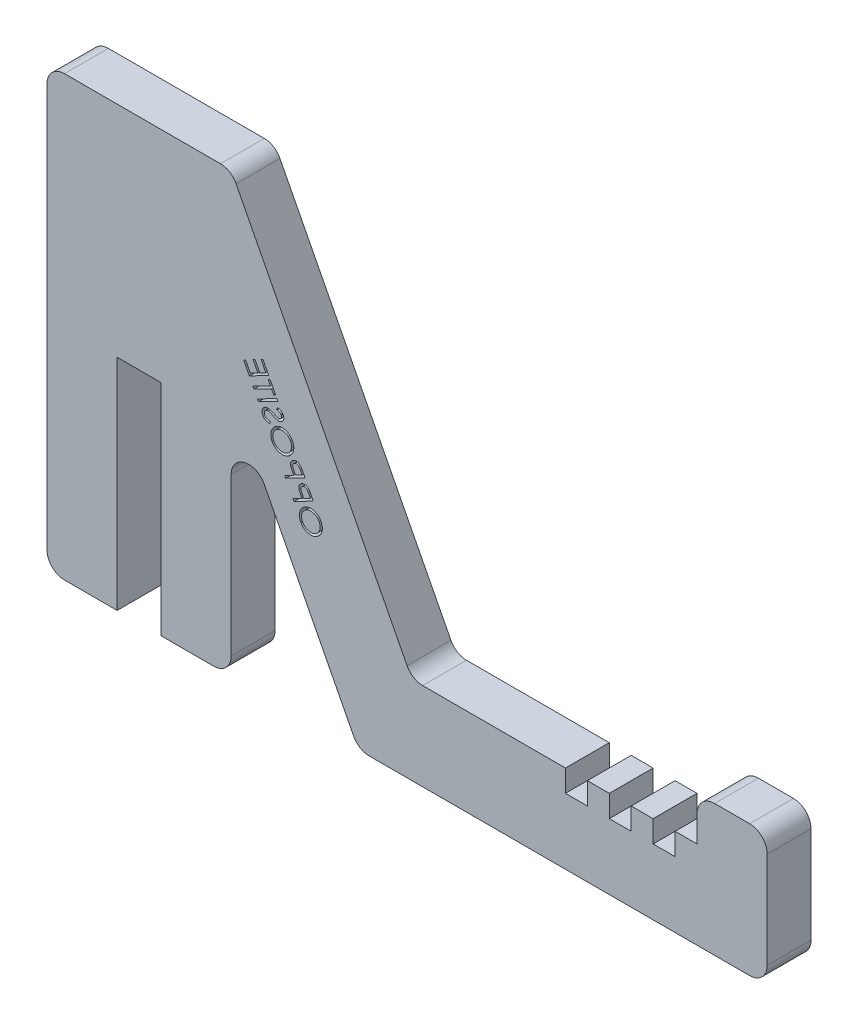
from build123d import *

# Parameters (mm, degrees)
BOSS_EXTRUDE1_DEPTH     = 5
FILLET1_R               = 2
CUT_EXTRUDE1_DEPTH      = 49.329493996
CUT_EXTRUDE1_DEPTH_BACK = 8
SKETCH2_W               = 5
SKETCH2_H               = 25
CUT_EXTRUDE4_DEPTH      = 49.329493996


with BuildPart() as part:
    # Sketch1 → Boss-Extrude1 (new body)
    with BuildSketch(Plane.XY):
        Polygon((33.057764064, -10), (33.057764064, -15), (30.557764064, -15), (30.557764064, -17.5), (28.057764064, -17.5), (28.057764064, -15), (25.557764064, -15), (25.557764064, -17.5), (23.057764064, -17.5), (23.057764064, -15), (20.557764064, -15), (20.557764064, -17.5), (18.057764064, -17.5), (18.057764064, -15), (0.557764064, -15), (-20.057764064, 25), (-41.057764064, 25), (-41.057764064, -25), (-20.057764064, -25), (-20.057764064, 3.171793747), (-5.538353904, -25), (41.057764064, -25), (41.057764064, -10), align=None)
    extrude(amount=BOSS_EXTRUDE1_DEPTH)

    # Fillet1
    fillet1_edges = [part.edges().sort_by_distance(p)[0] for p in [
        (-20.057764064, -25, 2.5),
        (33.057764064, -10, 2.5),
        (41.057764064, -10, 2.5),
        (-20.057764064, 25, 2.5),
        (-41.057764064, -25, 2.5),
        (-41.057764064, 25, 2.5),
        (0.557764064, -15, 2.5),
        (-20.057764064, 3.171793747, 2.5),
        (41.057764064, -25, 2.5),
        (-5.538353904, -25, 2.5),
    ]]
    fillet(fillet1_edges, radius=FILLET1_R)

    # Sketch2 → Cut-Extrude1 (cut, two sides: drawn at the far end of the back side and taken through both)
    with BuildSketch(Plane.XY.offset(5).offset(-CUT_EXTRUDE1_DEPTH_BACK)):
        with Locations((-30.557764064, -12.5)):
            Rectangle(SKETCH2_W, SKETCH2_H)
    extrude(amount=CUT_EXTRUDE1_DEPTH + CUT_EXTRUDE1_DEPTH_BACK, mode=Mode.SUBTRACT)

    # Sketch4 → Cut-Extrude4 (cut, through all)
    # profile 1 of 8: a face of its own
    with BuildSketch(Plane(origin=(0, 0, 0), x_dir=(-1, 0, 0), z_dir=(0, 0, -1))):
        with BuildLine():
            add(Edge.make_bspline(
                [(9.801511696, -4.616274929), (9.823613541, -4.575745177), (9.867081613, -4.496034631), (9.944488459, -4.386225626), (10.028726911, -4.286246843), (10.121388667, -4.197142968), (10.221836513, -4.11863564), (10.330475812, -4.051205195), (10.446530301, -3.994000471), (10.569120484, -3.947650159), (10.695479248, -3.913533136), (10.822492127, -3.890912918), (10.949084555, -3.882464064), (11.074950429, -3.88694773), (11.200319533, -3.904629357), (11.324897781, -3.9355014), (11.449018067, -3.978995717), (11.528788314, -4.017682089), (11.569340221, -4.037348647)],
                knots=[0, 0, 0, 0, 1.066632563, 2.097764254, 3.100015086, 4.085454937, 5.06445634, 6.042277714, 7.036537005, 8.051615149, 9.067514827, 10.058682713, 11.029693007, 11.99524916, 12.965768378, 13.951510535, 14.958632359, 16, 16, 16, 16], degree=3))
            add(Edge.make_bspline(
                [(11.569340221, -4.037348647), (11.608545277, -4.058770793), (11.685823696, -4.100996714), (11.791996135, -4.176961365), (11.889033766, -4.259918909), (11.976241765, -4.351090834), (12.051958732, -4.451764009), (12.118473941, -4.559787009), (12.174641522, -4.676129177), (12.220290073, -4.799052871), (12.254749979, -4.925586526), (12.276307002, -5.052900533), (12.285897126, -5.179388496), (12.28090647, -5.305066409), (12.264255658, -5.430061173), (12.232809452, -5.553764951), (12.190266789, -5.677227337), (12.151775411, -5.756455101), (12.132240862, -5.796663551)],
                knots=[0, 0, 0, 0, 1.04171479, 2.053359446, 3.039521027, 4.017679472, 4.990775246, 5.973545774, 6.973581496, 8.000330661, 9.029390157, 10.029069229, 11.00933521, 11.983825645, 12.958930967, 13.946230558, 14.957702701, 16, 16, 16, 16], degree=3))
            add(Edge.make_bspline(
                [(12.132240862, -5.796663551), (12.110437622, -5.836335529), (12.067497958, -5.914466183), (11.991348522, -6.022448556), (11.907290643, -6.120001464), (11.815852158, -6.208215553), (11.715047566, -6.284679051), (11.606804056, -6.351764854), (11.490580887, -6.408567019), (11.367666253, -6.454052283), (11.241453037, -6.488413581), (11.114743106, -6.510844963), (10.989036817, -6.520020457), (10.864367449, -6.515828605), (10.740637899, -6.499384607), (10.618013674, -6.469528592), (10.496367863, -6.426843667), (10.418170095, -6.389206118), (10.378434772, -6.370081019)],
                knots=[0, 0, 0, 0, 1.056990835, 2.081655299, 3.079996136, 4.062015271, 5.044104105, 6.030095945, 7.033035091, 8.061011973, 9.087537746, 10.085230842, 11.062778891, 12.0266078, 12.994625509, 13.973673958, 14.970345053, 16, 16, 16, 16], degree=3))
            add(Edge.make_bspline(
                [(10.378434772, -6.370081019), (10.352330337, -6.356113852), (10.300450458, -6.328355546), (10.227121644, -6.280070479), (10.156480763, -6.229528196), (10.091142078, -6.17326842), (10.028438872, -6.114551649), (9.971210044, -6.050381767), (9.916568394, -5.983316875), (9.866930523, -5.911774353), (9.821491129, -5.837841155), (9.781824837, -5.76156936), (9.746854683, -5.684046791), (9.718758487, -5.604260272), (9.694854077, -5.52345354), (9.676814123, -5.440945582), (9.664312971, -5.356780939), (9.657426976, -5.271460614), (9.655685975, -5.185796752), (9.660465463, -5.10100659), (9.669870551, -5.01717772), (9.684896653, -4.934686469), (9.705470696, -4.852976444), (9.732117648, -4.772802278), (9.763679399, -4.693410588), (9.788815314, -4.642161377), (9.801511696, -4.616274929)],
                knots=[0, 0, 0, 0, 1.037256786, 2.061441141, 3.075039414, 4.07978187, 5.081418259, 6.083977232, 7.091068454, 8.112155579, 9.133795872, 10.131012574, 11.123824406, 12.112211735, 13.093645848, 14.076160933, 15.070058586, 16.074033953, 17.074815338, 18.07098421, 19.04869556, 20.030042446, 21.007893874, 21.999739532, 22.989650014, 24, 24, 24, 24], degree=3))
        make_face()
        with BuildLine():
            add(Edge.make_bspline(
                [(10.023366664, -4.717436788), (10.013223256, -4.738003564), (9.993066644, -4.778873117), (9.968185841, -4.842224707), (9.947403968, -4.906579205), (9.931545049, -4.972422671), (9.919393794, -5.039448676), (9.911892913, -5.107888731), (9.908941726, -5.177480762), (9.910410024, -5.247910302), (9.916547915, -5.318121352), (9.926258082, -5.387284978), (9.941162468, -5.454757246), (9.959372339, -5.520812736), (9.982593319, -5.585213293), (10.010298378, -5.647823294), (10.04183959, -5.709172344), (10.077813295, -5.768574818), (10.117850876, -5.82558918), (10.161504767, -5.879804474), (10.208691661, -5.930991722), (10.259387254, -5.979169432), (10.313622699, -6.024288328), (10.371202349, -6.066466498), (10.432639331, -6.105116638), (10.475460148, -6.128422162), (10.497124676, -6.14021323)],
                knots=[0, 0, 0, 0, 0.989589386, 1.966476136, 2.935061073, 3.906857685, 4.887882231, 5.873896613, 6.876519821, 7.892853037, 8.912629515, 9.917503341, 10.905517114, 11.893425756, 12.873602947, 13.857745808, 14.847230231, 15.849542612, 16.853175341, 17.852582012, 18.852170537, 19.856346435, 20.869455381, 21.89572958, 22.935376976, 24, 24, 24, 24], degree=3))
            add(Edge.make_bspline(
                [(10.497124676, -6.14021323), (10.529729495, -6.15605362), (10.59388846, -6.187223951), (10.693826939, -6.222243589), (10.794114152, -6.246944816), (10.89513832, -6.261227776), (10.996494583, -6.264493673), (11.098561566, -6.258203703), (11.201029223, -6.240301475), (11.30284369, -6.212280329), (11.4018549, -6.175689321), (11.495258745, -6.130548915), (11.582290455, -6.077583291), (11.662476721, -6.016605176), (11.735456362, -5.947123313), (11.802651148, -5.870830236), (11.862438038, -5.785824396), (11.896254342, -5.724549463), (11.913390702, -5.693498486)],
                knots=[0, 0, 0, 0, 1.051790112, 2.069686862, 3.067737986, 4.046573341, 5.026236362, 6.00733714, 7.010553343, 8.040575373, 9.06963903, 10.071156048, 11.047889103, 12.023117742, 12.989999877, 13.968943228, 14.97076514, 16, 16, 16, 16], degree=3))
            add(Edge.make_bspline(
                [(11.913390702, -5.693498486), (11.924085359, -5.6721192), (11.945311587, -5.629686645), (11.970864695, -5.563738233), (11.99323747, -5.497525105), (12.010966862, -5.430309538), (12.023078544, -5.362087905), (12.032088725, -5.293259706), (12.035156191, -5.223612476), (12.034821186, -5.15355787), (12.030079106, -5.083896171), (12.019696562, -5.015389515), (12.00571874, -4.948328831), (11.987987581, -4.882530998), (11.964670126, -4.818703169), (11.936840434, -4.756499327), (11.905588169, -4.695328701), (11.869323462, -4.636262605), (11.829403331, -4.579487774), (11.786274815, -4.524992676), (11.739253369, -4.47390771), (11.688204106, -4.426495487), (11.634850416, -4.380827874), (11.576772336, -4.339820893), (11.516376903, -4.299984008), (11.473388621, -4.277222976), (11.45165192, -4.265714031)],
                knots=[0, 0, 0, 0, 1.027959219, 2.040242785, 3.039576589, 4.03427981, 5.02742605, 6.018934827, 7.018526689, 8.024061282, 9.032132035, 10.019417724, 11.002619592, 11.978369363, 12.948499141, 13.922767536, 14.908929245, 15.901737816, 16.902000321, 17.893561122, 18.889793003, 19.885662363, 20.889862266, 21.908470364, 22.942433777, 24, 24, 24, 24], degree=3))
            add(Edge.make_bspline(
                [(11.45165192, -4.265714031), (11.429732872, -4.254948387), (11.386441028, -4.233685393), (11.320135949, -4.206435134), (11.253207368, -4.184616728), (11.186141495, -4.166244027), (11.11833619, -4.153157485), (11.050010132, -4.1454685), (10.981461618, -4.141085801), (10.912675609, -4.142289003), (10.844462941, -4.147859928), (10.776792077, -4.157186307), (10.710360929, -4.171733753), (10.644964641, -4.191169042), (10.580228065, -4.213725266), (10.517175992, -4.242324072), (10.454657041, -4.274184662), (10.394144336, -4.311194686), (10.335632219, -4.351670541), (10.28016109, -4.395021315), (10.228295713, -4.441351288), (10.179915656, -4.49053779), (10.13554593, -4.543175142), (10.094445745, -4.598378779), (10.056320568, -4.656153649), (10.034413935, -4.696892592), (10.023366664, -4.717436788)],
                knots=[0, 0, 0, 0, 1.054707469, 2.083130161, 3.093315378, 4.093854564, 5.085230943, 6.072691992, 7.06228343, 8.050297243, 9.0413851, 10.017325617, 10.998924117, 11.975583657, 12.963176344, 13.957459493, 14.963699213, 15.992627396, 17.018772293, 18.035754999, 19.031631949, 20.020881782, 21.013437607, 22.002792562, 22.992830537, 24, 24, 24, 24], degree=3))
        make_face(mode=Mode.SUBTRACT)
    # profile 2 of 8: a face of its own
    with BuildSketch(Plane(origin=(0, 0, 0), x_dir=(-1, 0, 0), z_dir=(0, 0, -1))):
        with BuildLine():
            Line((10.692971556, -3.021946225), (10.920335338, -2.581741898))
            add(Edge.make_bspline(
                [(10.920335338, -2.581741898), (10.936152805, -2.551505532), (10.966371863, -2.493739362), (11.010368714, -2.411209556), (11.051998942, -2.337204828), (11.090323346, -2.271109749), (11.125823835, -2.213450395), (11.158345031, -2.164024518), (11.188189666, -2.122973284), (11.207866977, -2.098894765), (11.216809697, -2.087951834)],
                knots=[0, 0, 0, 0, 1.419510024, 2.71195483, 3.890283711, 4.951476777, 5.889999496, 6.706616563, 7.412197862, 8, 8, 8, 8], degree=3))
            add(Edge.make_bspline(
                [(11.216809697, -2.087951834), (11.228940049, -2.074544815), (11.25289034, -2.04807386), (11.292370274, -2.012531403), (11.333277368, -1.980425677), (11.376292499, -1.952058102), (11.421197134, -1.927614541), (11.468285389, -1.906896983), (11.517171326, -1.88990763), (11.567935003, -1.87693305), (11.619800362, -1.867725934), (11.672470139, -1.86377073), (11.725455688, -1.864775532), (11.778756557, -1.870879805), (11.832554912, -1.881957669), (11.88652108, -1.898229377), (11.941200165, -1.918561166), (11.976508059, -1.936205412), (11.994554088, -1.945223469)],
                knots=[0, 0, 0, 0, 1.011413309, 1.996944693, 2.968872661, 3.919961939, 4.877455315, 5.827120703, 6.796350115, 7.77083479, 8.757030353, 9.740965877, 10.722235868, 11.718998114, 12.739691427, 13.792179139, 14.871572489, 16, 16, 16, 16], degree=3))
            add(Edge.make_bspline(
                [(11.994554088, -1.945223469), (12.012417379, -1.954786708), (12.047392604, -1.973510944), (12.096096739, -2.005958755), (12.140908276, -2.040296665), (12.180933687, -2.07768307), (12.21755493, -2.116701073), (12.248944644, -2.158895968), (12.276209668, -2.203334129), (12.299377328, -2.249867472), (12.317552354, -2.298504898), (12.332620421, -2.348224932), (12.341679665, -2.399512638), (12.347512297, -2.45188441), (12.348171251, -2.50549069), (12.345442259, -2.560448115), (12.337193197, -2.616490795), (12.328826649, -2.653906167), (12.324582133, -2.672887731)],
                knots=[0, 0, 0, 0, 1.116554278, 2.18614466, 3.222632161, 4.225642221, 5.202640085, 6.169045809, 7.1193197, 8.074262178, 9.029781083, 9.979252341, 10.934194818, 11.896735958, 12.881721431, 13.886461366, 14.927759714, 16, 16, 16, 16], degree=3))
            add(Edge.make_bspline(
                [(12.324582133, -2.672887731), (12.320434367, -2.688305192), (12.311374681, -2.721980514), (12.29210954, -2.77550033), (12.268917085, -2.836986341), (12.239385664, -2.905770472), (12.204965094, -2.982057361), (12.165131589, -3.065991648), (12.120175547, -3.15754176), (12.087642377, -3.220817864), (12.070675883, -3.253817219)],
                knots=[0, 0, 0, 0, 0.603150067, 1.317420077, 2.148134559, 3.086716999, 4.145594464, 5.311116333, 6.597710332, 8, 8, 8, 8], degree=3))
            Line((12.070675883, -3.253817219), (11.989045274, -3.411569623))
            Line((11.989045274, -3.411569623), (13.016689505, -3.94191818))
            Line((13.016689505, -3.94191818), (12.903007614, -4.162771546))
            Line((12.903007614, -4.162771546), (10.692971556, -3.021946225))
        make_face()
        with BuildLine():
            Line((11.021497197, -2.911769943), (11.77269912, -3.299890937))
            Line((11.77269912, -3.299890937), (11.970515626, -2.927795584))
            add(Edge.make_bspline(
                [(11.970515626, -2.927795584), (11.979780831, -2.909474546), (11.997707149, -2.874026999), (12.022236819, -2.822156896), (12.043444811, -2.773219829), (12.061523604, -2.727516773), (12.075945808, -2.684821203), (12.087962181, -2.645547201), (12.095796802, -2.609152665), (12.102702927, -2.565334281), (12.104289306, -2.513084638), (12.09699919, -2.452498281), (12.07941033, -2.394475601), (12.053377123, -2.339481733), (12.019507344, -2.288794711), (11.978857474, -2.243227003), (11.930959741, -2.204458428), (11.895037866, -2.183959039), (11.876865787, -2.173588853)],
                knots=[0, 0, 0, 0, 1.137135783, 2.200130434, 3.177479121, 4.090939139, 4.921351381, 5.673257979, 6.364255076, 6.981471147, 8.12859989, 9.246782082, 10.346733602, 11.471737877, 12.605221442, 13.711721158, 14.842410562, 16, 16, 16, 16], degree=3))
            add(Edge.make_bspline(
                [(11.876865787, -2.173588853), (11.858233265, -2.164806216), (11.821582651, -2.147530558), (11.762798327, -2.132169856), (11.702785698, -2.124908949), (11.642050035, -2.127143132), (11.582795443, -2.137348082), (11.526793427, -2.156243042), (11.474662519, -2.182806847), (11.4347761, -2.212610949), (11.404578074, -2.241692172), (11.380793259, -2.268111293), (11.356438924, -2.299102838), (11.331479588, -2.334890109), (11.305481071, -2.375010274), (11.278417607, -2.419502052), (11.250961902, -2.468752947), (11.232764008, -2.50324507), (11.223320114, -2.521144943)],
                knots=[0, 0, 0, 0, 1.168264119, 2.298003391, 3.434531283, 4.592352176, 5.738536383, 6.839355403, 7.938088335, 9.049764743, 9.653550643, 10.318397515, 11.067971438, 11.891659399, 12.796692311, 13.784114278, 14.850054205, 16, 16, 16, 16], degree=3))
            Line((11.223320114, -2.521144943), (11.021497197, -2.911769943))
        make_face(mode=Mode.SUBTRACT)
    # profile 3 of 8: a face of its own
    with BuildSketch(Plane(origin=(0, 0, 0), x_dir=(-1, 0, 0), z_dir=(0, 0, -1))):
        with BuildLine():
            Line((11.63271073, -1.198584402), (11.860074512, -0.758380075))
            add(Edge.make_bspline(
                [(11.860074512, -0.758380075), (11.875891979, -0.728143709), (11.906111037, -0.670377538), (11.950107888, -0.587847733), (11.991738116, -0.513843004), (12.03006252, -0.447747926), (12.065563009, -0.390088572), (12.098084205, -0.340662694), (12.12792884, -0.299611461), (12.147606151, -0.275532941), (12.156548871, -0.264590011)],
                knots=[0, 0, 0, 0, 1.419510024, 2.71195483, 3.890283711, 4.951476777, 5.889999496, 6.706616563, 7.412197862, 8, 8, 8, 8], degree=3))
            add(Edge.make_bspline(
                [(12.156548871, -0.264590011), (12.168679223, -0.251182991), (12.192629514, -0.224712036), (12.232109448, -0.18916958), (12.273016542, -0.157063853), (12.316031673, -0.128696279), (12.360936308, -0.104252718), (12.408024563, -0.083535159), (12.4569105, -0.066545807), (12.507674177, -0.053571226), (12.559539536, -0.044364111), (12.612209313, -0.040408907), (12.665194862, -0.041413708), (12.718495731, -0.047517982), (12.772294086, -0.058595846), (12.826260254, -0.074867553), (12.880939339, -0.095199343), (12.916247233, -0.112843589), (12.934293262, -0.121861645)],
                knots=[0, 0, 0, 0, 1.011413309, 1.996944693, 2.968872661, 3.919961939, 4.877455315, 5.827120703, 6.796350115, 7.77083479, 8.757030353, 9.740965877, 10.722235868, 11.718998114, 12.739691427, 13.792179139, 14.871572489, 16, 16, 16, 16], degree=3))
            add(Edge.make_bspline(
                [(12.934293262, -0.121861645), (12.952156553, -0.131424885), (12.987131778, -0.150149121), (13.035835913, -0.182596931), (13.08064745, -0.216934842), (13.120672861, -0.254321247), (13.157294104, -0.293339249), (13.188683818, -0.335534145), (13.215948842, -0.379972306), (13.239116502, -0.426505649), (13.257291528, -0.475143074), (13.272359595, -0.524863109), (13.281418839, -0.576150815), (13.287251471, -0.628522586), (13.287910424, -0.682128867), (13.285181433, -0.737086292), (13.27693237, -0.793128971), (13.268565823, -0.830544344), (13.264321307, -0.849525908)],
                knots=[0, 0, 0, 0, 1.116554278, 2.18614466, 3.222632161, 4.225642221, 5.202640085, 6.169045809, 7.1193197, 8.074262178, 9.029781083, 9.979252341, 10.934194818, 11.896735958, 12.881721431, 13.886461366, 14.927759714, 16, 16, 16, 16], degree=3))
            add(Edge.make_bspline(
                [(13.264321307, -0.849525908), (13.260173541, -0.864943369), (13.251113855, -0.898618691), (13.231848714, -0.952138507), (13.208656259, -1.013624518), (13.179124838, -1.082408649), (13.144704267, -1.158695538), (13.104870762, -1.242629825), (13.059914721, -1.334179936), (13.027381551, -1.39745604), (13.010415057, -1.430455395)],
                knots=[0, 0, 0, 0, 0.603150067, 1.317420077, 2.148134559, 3.086716999, 4.145594464, 5.311116333, 6.597710332, 8, 8, 8, 8], degree=3))
            Line((13.010415057, -1.430455395), (12.928784448, -1.588207799))
            Line((12.928784448, -1.588207799), (13.956428679, -2.118556357))
            Line((13.956428679, -2.118556357), (13.842746788, -2.339409722))
            Line((13.842746788, -2.339409722), (11.63271073, -1.198584402))
        make_face()
        with BuildLine():
            Line((11.961236371, -1.08840812), (12.712438294, -1.476529113))
            Line((12.712438294, -1.476529113), (12.9102548, -1.104433761))
            add(Edge.make_bspline(
                [(12.9102548, -1.104433761), (12.919520005, -1.086112722), (12.937446323, -1.050665175), (12.961975993, -0.998795072), (12.983183985, -0.949858006), (13.001262778, -0.904154949), (13.015684982, -0.86145938), (13.027701355, -0.822185378), (13.035535976, -0.785790841), (13.0424421, -0.741972457), (13.04402848, -0.689722815), (13.036738364, -0.629136458), (13.019149504, -0.571113778), (12.993116296, -0.51611991), (12.959246518, -0.465432887), (12.918596648, -0.41986518), (12.870698915, -0.381096604), (12.83477704, -0.360597215), (12.816604961, -0.35022703)],
                knots=[0, 0, 0, 0, 1.137135783, 2.200130434, 3.177479121, 4.090939139, 4.921351381, 5.673257979, 6.364255076, 6.981471147, 8.12859989, 9.246782082, 10.346733602, 11.471737877, 12.605221442, 13.711721158, 14.842410562, 16, 16, 16, 16], degree=3))
            add(Edge.make_bspline(
                [(12.816604961, -0.35022703), (12.797972439, -0.341444392), (12.761321824, -0.324168735), (12.702537501, -0.308808032), (12.642524872, -0.301547126), (12.581789209, -0.303781309), (12.522534617, -0.313986259), (12.466532601, -0.332881218), (12.414401693, -0.359445024), (12.374515274, -0.389249126), (12.344317248, -0.418330348), (12.320532433, -0.44474947), (12.296178098, -0.475741015), (12.271218762, -0.511528285), (12.245220244, -0.55164845), (12.218156781, -0.596140228), (12.190701076, -0.645391124), (12.172503182, -0.679883247), (12.163059288, -0.69778312)],
                knots=[0, 0, 0, 0, 1.168264119, 2.298003391, 3.434531283, 4.592352176, 5.738536383, 6.839355403, 7.938088335, 9.049764743, 9.653550643, 10.318397515, 11.067971438, 11.891659399, 12.796692311, 13.784114278, 14.850054205, 16, 16, 16, 16], degree=3))
            Line((12.163059288, -0.69778312), (11.961236371, -1.08840812))
        make_face(mode=Mode.SUBTRACT)
    # profile 4 of 8: a face of its own
    with BuildSketch(Plane(origin=(0, 0, 0), x_dir=(-1, 0, 0), z_dir=(0, 0, -1))):
        with BuildLine():
            add(Edge.make_bspline(
                [(13.061231955, 1.708511396), (13.0833338, 1.749041148), (13.126801872, 1.828751694), (13.204208719, 1.938560698), (13.288447171, 2.038539482), (13.381108926, 2.127643357), (13.481556773, 2.206150685), (13.590196072, 2.27358113), (13.706250561, 2.330785854), (13.828840743, 2.377136165), (13.955199507, 2.411253188), (14.082212386, 2.433873407), (14.208804814, 2.442322261), (14.334670689, 2.437838595), (14.460039793, 2.420156968), (14.58461804, 2.389284925), (14.708738327, 2.345790608), (14.788508574, 2.307104236), (14.829060481, 2.287437678)],
                knots=[0, 0, 0, 0, 1.066632563, 2.097764254, 3.100015086, 4.085454937, 5.06445634, 6.042277714, 7.036537005, 8.051615149, 9.067514827, 10.058682713, 11.029693007, 11.99524916, 12.965768378, 13.951510535, 14.958632359, 16, 16, 16, 16], degree=3))
            add(Edge.make_bspline(
                [(14.829060481, 2.287437678), (14.868265537, 2.266015532), (14.945543955, 2.22378961), (15.051716395, 2.14782496), (15.148754025, 2.064867416), (15.235962024, 1.97369549), (15.311678991, 1.873022316), (15.3781942, 1.764999316), (15.434361782, 1.648657148), (15.480010333, 1.525733454), (15.514470238, 1.399199799), (15.536027262, 1.271885791), (15.545617386, 1.145397829), (15.540626729, 1.019719916), (15.523975918, 0.894725152), (15.492529712, 0.771021374), (15.449987048, 0.647558988), (15.41149567, 0.568331224), (15.391961122, 0.528122774)],
                knots=[0, 0, 0, 0, 1.04171479, 2.053359446, 3.039521027, 4.017679472, 4.990775246, 5.973545774, 6.973581496, 8.000330661, 9.029390157, 10.029069229, 11.00933521, 11.983825645, 12.958930967, 13.946230558, 14.957702701, 16, 16, 16, 16], degree=3))
            add(Edge.make_bspline(
                [(15.391961122, 0.528122774), (15.370157881, 0.488450795), (15.327218218, 0.410320142), (15.251068781, 0.302337768), (15.167010902, 0.204784861), (15.075572418, 0.116570772), (14.974767825, 0.040107274), (14.866524316, -0.026978529), (14.750301147, -0.083780695), (14.627386513, -0.129265958), (14.501173297, -0.163627257), (14.374463365, -0.186058639), (14.248757077, -0.195234132), (14.124087709, -0.19104228), (14.000358158, -0.174598282), (13.877733934, -0.144742267), (13.756088122, -0.102057342), (13.677890354, -0.064419794), (13.638155032, -0.045294694)],
                knots=[0, 0, 0, 0, 1.056990835, 2.081655299, 3.079996136, 4.062015271, 5.044104105, 6.030095945, 7.033035091, 8.061011973, 9.087537746, 10.085230842, 11.062778891, 12.0266078, 12.994625509, 13.973673958, 14.970345053, 16, 16, 16, 16], degree=3))
            add(Edge.make_bspline(
                [(13.638155032, -0.045294694), (13.612050597, -0.031327527), (13.560170717, -0.003569221), (13.486841904, 0.044715846), (13.416201023, 0.095258129), (13.350862337, 0.151517905), (13.288159131, 0.210234676), (13.230930304, 0.274404558), (13.176288653, 0.34146945), (13.126650783, 0.413011972), (13.081211388, 0.48694517), (13.041545096, 0.563216965), (13.006574943, 0.640739534), (12.978478746, 0.720526053), (12.954574336, 0.801332785), (12.936534383, 0.883840743), (12.92403323, 0.968005386), (12.917147236, 1.053325711), (12.915406235, 1.138989573), (12.920185723, 1.223779735), (12.92959081, 1.307608605), (12.944616912, 1.390099856), (12.965190955, 1.471809881), (12.991837908, 1.551984047), (13.023399659, 1.631375737), (13.048535573, 1.682624948), (13.061231955, 1.708511396)],
                knots=[0, 0, 0, 0, 1.037256786, 2.061441141, 3.075039414, 4.07978187, 5.081418259, 6.083977232, 7.091068454, 8.112155579, 9.133795872, 10.131012574, 11.123824406, 12.112211735, 13.093645848, 14.076160933, 15.070058586, 16.074033953, 17.074815338, 18.07098421, 19.04869556, 20.030042446, 21.007893874, 21.999739532, 22.989650014, 24, 24, 24, 24], degree=3))
        make_face()
        with BuildLine():
            add(Edge.make_bspline(
                [(13.283086923, 1.607349537), (13.272943516, 1.58678276), (13.252786904, 1.545913208), (13.227906101, 1.482561617), (13.207124227, 1.41820712), (13.191265309, 1.352363654), (13.179114053, 1.285337649), (13.171613173, 1.216897594), (13.168661986, 1.147305563), (13.170130284, 1.076876023), (13.176268175, 1.006664972), (13.185978341, 0.937501347), (13.200882727, 0.870029079), (13.219092598, 0.803973589), (13.242313579, 0.739573031), (13.270018637, 0.676963031), (13.301559849, 0.615613981), (13.337533555, 0.556211506), (13.377571136, 0.499197144), (13.421225026, 0.444981851), (13.46841192, 0.393794603), (13.519107513, 0.345616893), (13.573342959, 0.300497997), (13.630922609, 0.258319827), (13.692359591, 0.219669687), (13.735180407, 0.196364163), (13.756844936, 0.184573095)],
                knots=[0, 0, 0, 0, 0.989589386, 1.966476136, 2.935061073, 3.906857685, 4.887882231, 5.873896613, 6.876519821, 7.892853037, 8.912629515, 9.917503341, 10.905517114, 11.893425756, 12.873602947, 13.857745808, 14.847230231, 15.849542612, 16.853175341, 17.852582012, 18.852170537, 19.856346435, 20.869455381, 21.89572958, 22.935376976, 24, 24, 24, 24], degree=3))
            add(Edge.make_bspline(
                [(13.756844936, 0.184573095), (13.789449755, 0.168732705), (13.85360872, 0.137562374), (13.953547199, 0.102542736), (14.053834412, 0.077841509), (14.15485858, 0.063558549), (14.256214843, 0.060292652), (14.358281825, 0.066582622), (14.460749482, 0.08448485), (14.56256395, 0.112505996), (14.66157516, 0.149097004), (14.754979004, 0.19423741), (14.842010715, 0.247203033), (14.922196981, 0.308181149), (14.995176621, 0.377663012), (15.062371408, 0.453956088), (15.122158297, 0.538961928), (15.155974602, 0.600236861), (15.173110962, 0.631287838)],
                knots=[0, 0, 0, 0, 1.051790112, 2.069686862, 3.067737986, 4.046573341, 5.026236362, 6.00733714, 7.010553343, 8.040575373, 9.06963903, 10.071156048, 11.047889103, 12.023117742, 12.989999877, 13.968943228, 14.97076514, 16, 16, 16, 16], degree=3))
            add(Edge.make_bspline(
                [(15.173110962, 0.631287838), (15.183805619, 0.652667125), (15.205031847, 0.69509968), (15.230584955, 0.761048092), (15.252957729, 0.827261219), (15.270687122, 0.894476787), (15.282798804, 0.962698419), (15.291808984, 1.031526619), (15.29487645, 1.101173849), (15.294541446, 1.171228454), (15.289799366, 1.240890154), (15.279416821, 1.30939681), (15.265438999, 1.376457494), (15.247707841, 1.442255327), (15.224390386, 1.506083156), (15.196560694, 1.568286998), (15.165308429, 1.629457624), (15.129043721, 1.688523719), (15.08912359, 1.745298551), (15.045995075, 1.799793649), (14.998973628, 1.850878615), (14.947924366, 1.898290838), (14.894570676, 1.94395845), (14.836492595, 1.984965431), (14.776097163, 2.024802317), (14.733108881, 2.047563349), (14.711372179, 2.059072293)],
                knots=[0, 0, 0, 0, 1.027959219, 2.040242785, 3.039576589, 4.03427981, 5.02742605, 6.018934827, 7.018526689, 8.024061282, 9.032132035, 10.019417724, 11.002619592, 11.978369363, 12.948499141, 13.922767536, 14.908929245, 15.901737816, 16.902000321, 17.893561122, 18.889793003, 19.885662363, 20.889862266, 21.908470364, 22.942433777, 24, 24, 24, 24], degree=3))
            add(Edge.make_bspline(
                [(14.711372179, 2.059072293), (14.689453131, 2.069837938), (14.646161288, 2.091100932), (14.579856208, 2.11835119), (14.512927627, 2.140169597), (14.445861754, 2.158542297), (14.37805645, 2.17162884), (14.309730391, 2.179317825), (14.241181877, 2.183700524), (14.172395869, 2.182497322), (14.1041832, 2.176926397), (14.036512337, 2.167600018), (13.970081189, 2.153052572), (13.904684901, 2.133617283), (13.839948324, 2.111061059), (13.776896251, 2.082462253), (13.714377301, 2.050601663), (13.653864596, 2.013591639), (13.595352478, 1.973115784), (13.53988135, 1.92976501), (13.488015973, 1.883435036), (13.439635915, 1.834248535), (13.395266189, 1.781611183), (13.354166004, 1.726407546), (13.316040828, 1.668632676), (13.294134194, 1.627893732), (13.283086923, 1.607349537)],
                knots=[0, 0, 0, 0, 1.054707469, 2.083130161, 3.093315378, 4.093854564, 5.085230943, 6.072691992, 7.06228343, 8.050297243, 9.0413851, 10.017325617, 10.998924117, 11.975583657, 12.963176344, 13.957459493, 14.963699213, 15.992627396, 17.018772293, 18.035754999, 19.031631949, 20.020881782, 21.013437607, 22.002792562, 22.992830537, 24, 24, 24, 24], degree=3))
        make_face(mode=Mode.SUBTRACT)
    # profile 5 of 8: a face of its own
    with BuildSketch(Plane(origin=(0, 0, 0), x_dir=(-1, 0, 0), z_dir=(0, 0, -1))):
        with BuildLine():
            Line((15.633881719, 2.147491542), (15.617856078, 2.393885773))
            add(Edge.make_bspline(
                [(15.617856078, 2.393885773), (15.655127124, 2.395448882), (15.726424416, 2.398439018), (15.828255903, 2.412323477), (15.919768744, 2.4341278), (16.001202311, 2.463214697), (16.072102067, 2.501065836), (16.132260131, 2.547178847), (16.183591408, 2.600379961), (16.207764847, 2.642375359), (16.219819219, 2.663316863)],
                knots=[0, 0, 0, 0, 1.292063475, 2.47164048, 3.554689806, 4.546504908, 5.460076821, 6.326585784, 7.165532124, 8, 8, 8, 8], degree=3))
            add(Edge.make_bspline(
                [(16.219819219, 2.663316863), (16.228664875, 2.681979453), (16.246184194, 2.718941763), (16.263574746, 2.777659115), (16.27363668, 2.837716136), (16.276461558, 2.898539438), (16.273028569, 2.958704064), (16.260728069, 3.016082647), (16.241700586, 3.070255573), (16.214513436, 3.11980689), (16.181929895, 3.164973614), (16.144711936, 3.205051039), (16.102260746, 3.239057086), (16.070844513, 3.256842404), (16.055055598, 3.265780805)],
                knots=[0, 0, 0, 0, 1.069206052, 2.117622752, 3.16174587, 4.218661991, 5.267935299, 6.275975927, 7.250327606, 8.233704792, 9.194320259, 10.130942197, 11.060664136, 12, 12, 12, 12], degree=3))
            add(Edge.make_bspline(
                [(16.055055598, 3.265780805), (16.03611609, 3.274531901), (15.997856115, 3.292210118), (15.934671402, 3.30539078), (15.867701468, 3.310323911), (15.822165879, 3.305719316), (15.798645341, 3.303340901)],
                knots=[0, 0, 0, 0, 0.948731457, 1.916546201, 2.923831773, 4, 4, 4, 4], degree=3))
            add(Edge.make_bspline(
                [(15.798645341, 3.303340901), (15.781072382, 3.300568262), (15.7441743, 3.294746529), (15.686914138, 3.280720977), (15.625147171, 3.262689206), (15.558658551, 3.240466792), (15.487562836, 3.213767557), (15.411666497, 3.1828815), (15.331406285, 3.146965127), (15.276604131, 3.121300266), (15.248264732, 3.108028401)],
                knots=[0, 0, 0, 0, 0.728311158, 1.529240754, 2.411979149, 3.363220765, 4.399428958, 5.521709504, 6.718421469, 8, 8, 8, 8], degree=3))
            add(Edge.make_bspline(
                [(15.248264732, 3.108028401), (15.220097417, 3.094578247), (15.166446665, 3.068959517), (15.088959366, 3.033776622), (15.018753881, 3.003170691), (14.955167886, 2.977645405), (14.898972478, 2.955723637), (14.849388563, 2.939470688), (14.807172441, 2.926533287), (14.78090068, 2.921849274), (14.768997905, 2.919727119)],
                knots=[0, 0, 0, 0, 1.45128976, 2.764295641, 3.956735847, 5.01179774, 5.950237039, 6.760220493, 7.438301202, 8, 8, 8, 8], degree=3))
            add(Edge.make_bspline(
                [(14.768997905, 2.919727119), (14.751166343, 2.917112809), (14.715956099, 2.911950586), (14.663196101, 2.909103315), (14.611621704, 2.909966731), (14.561069294, 2.915127003), (14.511516338, 2.923800763), (14.463345716, 2.937857381), (14.415785948, 2.954439853), (14.385581627, 2.969319719), (14.370360085, 2.976818465)],
                knots=[0, 0, 0, 0, 1.054778267, 2.082767634, 3.089723667, 4.072041692, 5.055574706, 6.030325999, 7.007377911, 8, 8, 8, 8], degree=3))
            add(Edge.make_bspline(
                [(14.370360085, 2.976818465), (14.347240299, 2.989701116), (14.301561132, 3.015154154), (14.240929143, 3.064102015), (14.187126659, 3.119010177), (14.141574619, 3.180653944), (14.104797247, 3.247826645), (14.078319772, 3.319607404), (14.060752237, 3.394968423), (14.054980641, 3.473346194), (14.057364193, 3.552653856), (14.071571671, 3.63091714), (14.094194533, 3.70791597), (14.11728138, 3.756499747), (14.128973867, 3.781105324)],
                knots=[0, 0, 0, 0, 1.015494288, 2.006373835, 2.981764702, 3.963317478, 4.942246197, 5.914594375, 6.895035408, 7.905675072, 8.926424322, 9.935760039, 10.954551954, 12, 12, 12, 12], degree=3))
            add(Edge.make_bspline(
                [(14.128973867, 3.781105324), (14.14321719, 3.806204557), (14.171500859, 3.856045339), (14.224637259, 3.923603109), (14.286466201, 3.98314419), (14.344646895, 4.026537118), (14.396690313, 4.057017817), (14.440062831, 4.079013422), (14.48791214, 4.099132647), (14.540311705, 4.116805995), (14.596634375, 4.134035326), (14.657564013, 4.148832103), (14.722534963, 4.162392883), (14.767466006, 4.169886509), (14.79053236, 4.173733529)],
                knots=[0, 0, 0, 0, 1.293334121, 2.568237267, 3.839329495, 5.134938231, 5.813090837, 6.543214745, 7.315157292, 8.139349379, 9.023076353, 9.956674518, 10.95101323, 12, 12, 12, 12], degree=3))
            Line((14.79053236, 4.173733529), (14.834102072, 3.922832087))
            add(Edge.make_bspline(
                [(14.834102072, 3.922832087), (14.815544651, 3.919638222), (14.779818781, 3.913489543), (14.728616861, 3.902272808), (14.681515066, 3.890802702), (14.638296969, 3.878996663), (14.599264275, 3.86589403), (14.564258749, 3.852550871), (14.5333152, 3.838617766), (14.498278323, 3.818668313), (14.459532774, 3.790755278), (14.41828175, 3.752344382), (14.382940448, 3.708027541), (14.364257023, 3.675042755), (14.354835245, 3.65840901)],
                knots=[0, 0, 0, 0, 1.187661553, 2.286429869, 3.305457505, 4.245647697, 5.111423451, 5.901460933, 6.608233149, 7.249532039, 8.441806069, 9.611404706, 10.795466356, 12, 12, 12, 12], degree=3))
            add(Edge.make_bspline(
                [(14.354835245, 3.65840901), (14.344617373, 3.6365246), (14.324968517, 3.59444112), (14.310279696, 3.527460617), (14.308370658, 3.461541135), (14.320707541, 3.397694445), (14.344558611, 3.338600754), (14.379292751, 3.286478762), (14.42403678, 3.242030263), (14.460454375, 3.220947765), (14.479033963, 3.210191863)],
                knots=[0, 0, 0, 0, 1.112238811, 2.138823042, 3.141046359, 4.137205629, 5.119039568, 6.063874918, 7.012224546, 8, 8, 8, 8], degree=3))
            add(Edge.make_bspline(
                [(14.479033963, 3.210191863), (14.491115756, 3.204438219), (14.515454092, 3.192847712), (14.553730965, 3.179978776), (14.593542155, 3.171395265), (14.635151843, 3.166667353), (14.680053664, 3.167329035), (14.728765255, 3.173832772), (14.782231443, 3.184819141), (14.81882491, 3.195860043), (14.838108482, 3.201678241)],
                knots=[0, 0, 0, 0, 0.868058226, 1.748671872, 2.613681537, 3.507528286, 4.461113946, 5.520169859, 6.693209817, 8, 8, 8, 8], degree=3))
            add(Edge.make_bspline(
                [(14.838108482, 3.201678241), (14.844812592, 3.204115527), (14.860727649, 3.209901464), (14.887802092, 3.222007479), (14.923018881, 3.236609527), (14.965254357, 3.256372256), (15.01499233, 3.279924343), (15.07203086, 3.307761946), (15.137197924, 3.338323967), (15.18270843, 3.360999437), (15.206698226, 3.372952279)],
                knots=[0, 0, 0, 0, 0.420971853, 0.99935581, 1.74982976, 2.671395585, 3.751319426, 4.998606538, 6.417885865, 8, 8, 8, 8], degree=3))
            add(Edge.make_bspline(
                [(15.206698226, 3.372952279), (15.235820361, 3.387169237), (15.292346093, 3.414764191), (15.375803289, 3.451588566), (15.454905466, 3.483969026), (15.529451152, 3.511584324), (15.600052064, 3.533748108), (15.666059978, 3.551258117), (15.727611583, 3.564836042), (15.785452548, 3.572271294), (15.840157135, 3.575691817), (15.892833573, 3.576398487), (15.943892703, 3.573472672), (15.993207989, 3.566786861), (16.040978743, 3.557442311), (16.087038859, 3.544406288), (16.131495099, 3.527933712), (16.159664161, 3.514088207), (16.173745501, 3.507167023)],
                knots=[0, 0, 0, 0, 1.533925611, 2.977332101, 4.31708358, 5.579567817, 6.739214287, 7.818337074, 8.811774092, 9.720379341, 10.575597986, 11.405357199, 12.212765738, 12.993956391, 13.759523671, 14.514991868, 15.257664131, 16, 16, 16, 16], degree=3))
            add(Edge.make_bspline(
                [(16.173745501, 3.507167023), (16.193194369, 3.496385429), (16.231584266, 3.475103766), (16.284336924, 3.436426051), (16.332846523, 3.393881335), (16.376037532, 3.346162782), (16.413714394, 3.293496383), (16.446952671, 3.236520953), (16.47562879, 3.174933757), (16.498099231, 3.109168496), (16.515879549, 3.041637544), (16.526424021, 2.973331411), (16.529902251, 2.9053768), (16.526822945, 2.837978387), (16.517599159, 2.770887431), (16.499922372, 2.704516844), (16.476696718, 2.638148664), (16.456115113, 2.59536434), (16.445680598, 2.573673433)],
                knots=[0, 0, 0, 0, 0.987830363, 1.949867011, 2.901540926, 3.852635822, 4.804309736, 5.775578319, 6.781752512, 7.819248272, 8.861538143, 9.882900012, 10.886223227, 11.881774821, 12.878929781, 13.890618495, 14.930580288, 16, 16, 16, 16], degree=3))
            add(Edge.make_bspline(
                [(16.445680598, 2.573673433), (16.436743836, 2.557170926), (16.419139008, 2.524662083), (16.388671331, 2.478714032), (16.355493171, 2.435740069), (16.320243284, 2.394867399), (16.281177423, 2.357940107), (16.240200427, 2.323044273), (16.195989015, 2.29164156), (16.149102047, 2.262798529), (16.098835206, 2.236998853), (16.044303674, 2.21531624), (15.986142019, 2.195375344), (15.923552474, 2.179869383), (15.857101949, 2.166480145), (15.786272834, 2.15753007), (15.711479139, 2.150079201), (15.660109345, 2.148366161), (15.633881719, 2.147491542)],
                knots=[0, 0, 0, 0, 0.929870591, 1.831783345, 2.7287864, 3.620046493, 4.503707468, 5.390462232, 6.28597566, 7.188533437, 8.117372639, 9.082328581, 10.094957779, 11.162615653, 12.275826215, 13.453065485, 14.699624065, 16, 16, 16, 16], degree=3))
        make_face()
    # profile 6 of 8: a face of its own
    with BuildSketch(Plane(origin=(0, 0, 0), x_dir=(-1, 0, 0), z_dir=(0, 0, -1))):
        Polygon((14.730071904, 4.811253561), (14.843753795, 5.032106927), (17.053789853, 3.891281606), (16.940107962, 3.670428241), align=None)
    # profile 7 of 8: a face of its own
    with BuildSketch(Plane(origin=(0, 0, 0), x_dir=(-1, 0, 0), z_dir=(0, 0, -1))):
        Polygon((15.200162395, 5.196536681), (14.985318645, 5.307213764), (15.611320248, 6.519653668), (15.826163998, 6.408976585), (15.571756947, 5.916188123), (17.566949254, 4.886039886), (17.450763357, 4.660679309), (15.455571049, 5.690827546), align=None)
    # profile 8 of 8: a face of its own
    with BuildSketch(Plane(origin=(0, 0, 0), x_dir=(-1, 0, 0), z_dir=(0, 0, -1))):
        Polygon((15.774938869, 6.83860844), (16.428985343, 8.105134882), (16.646833901, 7.992955395), (16.106469318, 6.947282318), (16.797575087, 6.590211004), (17.332931657, 7.626869658), (17.549277811, 7.515190972), (17.013921241, 6.478532318), (17.88080826, 6.031316774), (18.41616483, 7.067975427), (18.634013388, 6.955295139), (17.984974927, 5.69778312), align=None)
    extrude(amount=-CUT_EXTRUDE4_DEPTH, mode=Mode.SUBTRACT)


with BuildPart() as cut_extrude4_piece_1:
    # of the separate pieces the step leaves, piece 1, a body of its own (cut_extrude4_pieces)
    add(part.part.solids().sort_by_distance((33.057764064, -12, 0))[0])


with BuildPart() as cut_extrude4_piece_2:
    # of the separate pieces the step leaves, piece 2, a body of its own (cut_extrude4_pieces)
    add(part.part.solids().sort_by_distance((-10.023366664, -4.717436788, 0))[0])


with BuildPart() as cut_extrude4_piece_3:
    # of the separate pieces the step leaves, piece 3, a body of its own (cut_extrude4_pieces)
    add(part.part.solids().sort_by_distance((-13.283086923, 1.607349537, 0))[0])


with BuildPart() as cut_extrude4_piece_4:
    # of the separate pieces the step leaves, piece 4, a body of its own (cut_extrude4_pieces)
    add(part.part.solids().sort_by_distance((-11.021497197, -2.911769943, 0))[0])


with BuildPart() as cut_extrude4_piece_5:
    # of the separate pieces the step leaves, piece 5, a body of its own (cut_extrude4_pieces)
    add(part.part.solids().sort_by_distance((-11.961236371, -1.08840812, 0))[0])


solid = Compound([cut_extrude4_piece_1.part, cut_extrude4_piece_2.part, cut_extrude4_piece_3.part, cut_extrude4_piece_4.part, cut_extrude4_piece_5.part])
